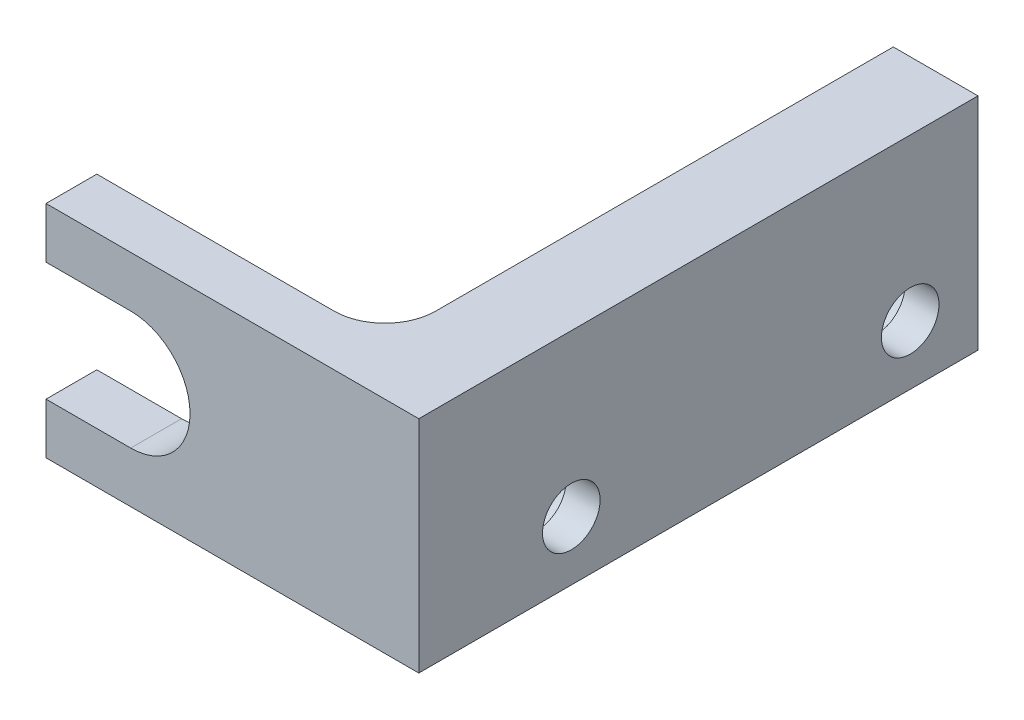
from build123d import *

# Parameters (mm, degrees)
SKETCH_1_W                = 22
SKETCH_1_H                = 13
EXTRUDE_1_DEPTH           = 33
SKETCH_5_W                = 30
SKETCH_5_H                = 13
CUT_EXTRUDE_2_DEPTH       = 17
HOLE_WIZARD_1_D           = 3.4
HOLE_WIZARD_1_CBORE_D     = 6
HOLE_WIZARD_1_CBORE_DEPTH = 3
CUT_EXTRUDE_4_DEPTH       = 36.387144558
FILLET_1_R                = 3


with BuildPart() as part:
    # 草图1 → 凸台-拉伸1 (new body)
    with BuildSketch(Plane.XY):
        Rectangle(SKETCH_1_W, SKETCH_1_H)
    extrude(amount=EXTRUDE_1_DEPTH)

    # 草图5 → 切除-拉伸2 (cut)
    with BuildSketch(Plane.ZY.offset(11)):
        with Locations((15, 0)):
            Rectangle(SKETCH_5_W, SKETCH_5_H)
    extrude(amount=-CUT_EXTRUDE_2_DEPTH, mode=Mode.SUBTRACT)

    # 打孔尺寸根据内六角圆柱头螺钉的类型1 (through all)
    with Locations(Plane(origin=(6, 5.532872615, -4.059557146), x_dir=(0, 0, 1), z_dir=(-1, 0, 0))):
        with Locations((28.059557146, -8.532872615), (8.059557146, -8.532872615)):
            CounterBoreHole(HOLE_WIZARD_1_D / 2, HOLE_WIZARD_1_CBORE_D / 2, HOLE_WIZARD_1_CBORE_DEPTH)

    # 草图12 → 切除-拉伸4 (cut, through all)
    with BuildSketch(Plane.XY.offset(33)):
        with BuildLine():
            Line((-11, -3.5), (-6, -3.5))
            ThreePointArc((-6, -3.5), (-2.5, 0), (-6, 3.5))
            Line((-6, 3.5), (-11, 3.5))
            Line((-11, 3.5), (-11, -3.5))
        make_face()
    extrude(amount=-CUT_EXTRUDE_4_DEPTH, mode=Mode.SUBTRACT)

    # 圆角1
    fillet_1_edges = [part.edges().sort_by_distance(p)[0] for p in [
        (6, 0, 30),
    ]]
    fillet(fillet_1_edges, radius=FILLET_1_R - 0.0001)  # a hair under: the kernel refuses the full size


solid = part.part
